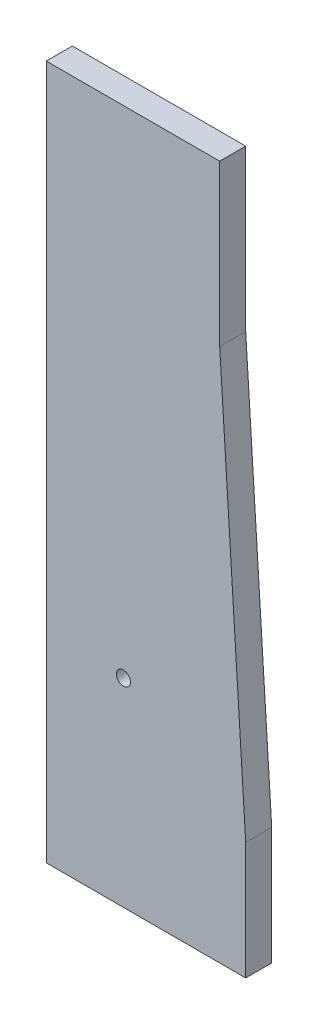
from build123d import *

# Parameters (mm, degrees)
BOSS_EXTRUDE1_DEPTH     = 19.05
F_3_8_CLEARANCE_HOLE1_D = 10.31748


with BuildPart() as part:
    # Sketch1 → Boss-Extrude1 (new body)
    with BuildSketch(Plane.XY):
        Polygon((82.03946, -5024.878404071), (82.03946, -5533.415502988), (228.088766336, -5533.415502988), (228.088766336, -5447.34166837), (209.03946, -5142.552766987), (209.03946, -5024.878404071), align=None)
    extrude(amount=BOSS_EXTRUDE1_DEPTH)

    # 3/8 Clearance Hole1 (through all)
    with Locations(Plane.XY.offset(19.05)):
        with Locations((138.550999994, -5387.96381451)):
            Hole(F_3_8_CLEARANCE_HOLE1_D / 2)


solid = part.part
